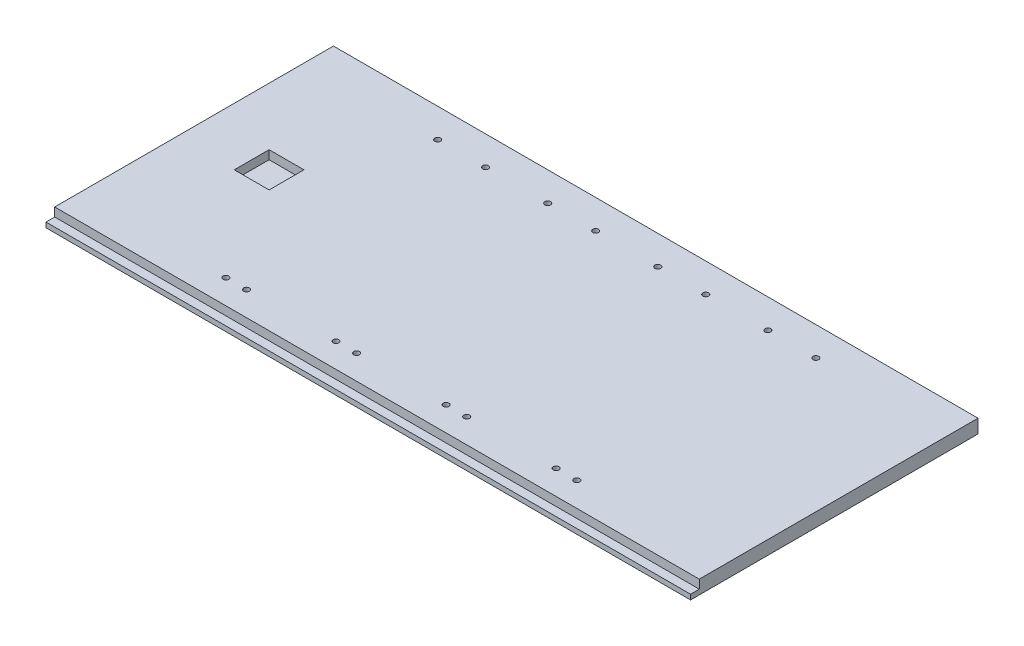
from build123d import *

# Parameters (mm, degrees)
SKETCH3_W           = 469.9
SKETCH3_H           = 209.55
BOSS_EXTRUDE1_DEPTH = 10
SKETCH4_R           = 2.1
CUT_EXTRUDE3_DEPTH  = 258.447670654
SKETCH5_R           = 2.1
CUT_EXTRUDE4_DEPTH  = 258.447670654
SKETCH7_W           = 25.4
SKETCH7_H           = 25.4
CUT_EXTRUDE5_DEPTH  = 6.35
CUT_EXTRUDE6_REACH  = 483.543
SKETCH8_W           = 6.35
SKETCH8_H           = 6.35


with BuildPart() as part:
    # Sketch3 → Boss-Extrude1 (new body)
    with BuildSketch(Plane(origin=(0, 0, 0), x_dir=(1, 0, 0), z_dir=(0, 1, 0))):
        Rectangle(SKETCH3_W, SKETCH3_H)
    extrude(amount=BOSS_EXTRUDE1_DEPTH)

    # Sketch4 → Cut-Extrude3 (cut, through all)
    with BuildSketch(Plane(origin=(0, 10, 0), x_dir=(1, 0, 0), z_dir=(0, 1, 0))):
        with Locations((-102.9, 83.65)):
            Circle(SKETCH4_R)
        with Locations((-22.65, 83.65)):
            Circle(SKETCH4_R)
        with Locations((57.6, 83.65)):
            Circle(SKETCH4_R)
        with Locations((137.85, 83.65)):
            Circle(SKETCH4_R)
        with Locations((112.85, -80.65)):
            Circle(SKETCH4_R)
        with Locations((32.6, -80.65)):
            Circle(SKETCH4_R)
        with Locations((-47.65, -80.65)):
            Circle(SKETCH4_R)
        with Locations((-127.9, -80.65)):
            Circle(SKETCH4_R)
    extrude(amount=-CUT_EXTRUDE3_DEPTH, mode=Mode.SUBTRACT)

    # Sketch5 → Cut-Extrude4 (cut, through all)
    with BuildSketch(Plane(origin=(0, 10, 0), x_dir=(1, 0, 0), z_dir=(0, 1, 0))):
        with Locations((-137.85, 83.65)):
            Circle(SKETCH5_R)
        with Locations((-57.6, 83.65)):
            Circle(SKETCH5_R)
        with Locations((22.65, 83.65)):
            Circle(SKETCH5_R)
        with Locations((102.9, 83.65)):
            Circle(SKETCH5_R)
        with Locations((-112.85, -80.65)):
            Circle(SKETCH5_R)
        with Locations((-32.6, -80.65)):
            Circle(SKETCH5_R)
        with Locations((47.65, -80.65)):
            Circle(SKETCH5_R)
        with Locations((127.9, -80.65)):
            Circle(SKETCH5_R)
    extrude(amount=-CUT_EXTRUDE4_DEPTH, mode=Mode.SUBTRACT)

    # Sketch7 → Cut-Extrude5 (cut)
    with BuildSketch(Plane(origin=(0, 10, 0), x_dir=(1, 0, 0), z_dir=(0, 1, 0))):
        with Locations((-180.25, 3.175)):
            Rectangle(SKETCH7_W, SKETCH7_H)
    extrude(amount=-CUT_EXTRUDE5_DEPTH, mode=Mode.SUBTRACT)

    # Sketch8 → Cut-Extrude6 (cut, up to next)
    with BuildSketch(Plane.ZY.offset(234.95), mode=Mode.PRIVATE) as cut_extrude6_sk1:
        with Locations((101.6, 6.825)):
            Rectangle(SKETCH8_W, SKETCH8_H)
    cut_extrude6_tool1 = extrude(cut_extrude6_sk1.sketch, amount=-CUT_EXTRUDE6_REACH, mode=Mode.PRIVATE) & part.part
    add(cut_extrude6_tool1.solids().sort_by_distance((-234.95, 6.825, 101.6))[0], mode=Mode.SUBTRACT)


solid = part.part
